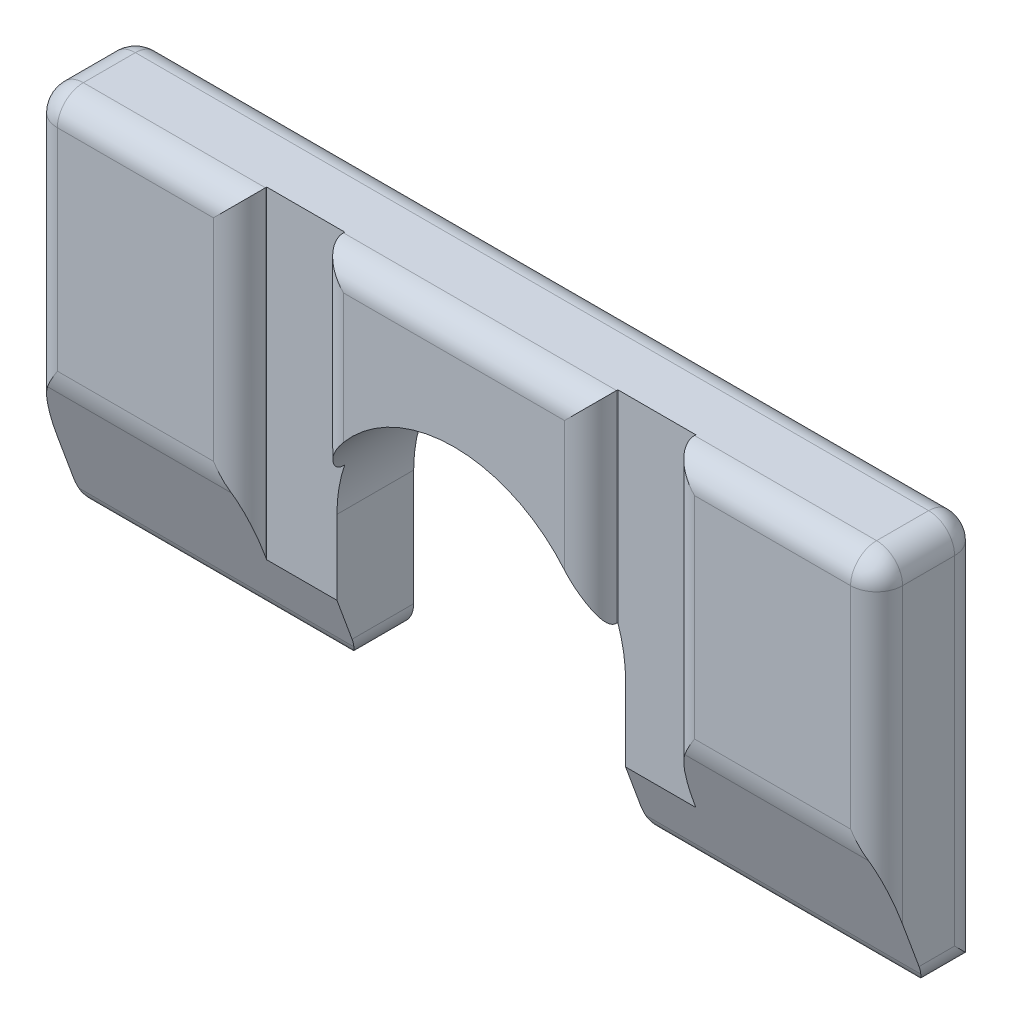
from build123d import *

# Parameters (mm, degrees)
EXTRUDE_1_DEPTH     = 8
SKETCH_3_W          = 6
SKETCH_3_H          = 30
CUT_EXTRUDE_2_DEPTH = 2.1
CUT_EXTRUDE_3_DEPTH = 68.186308129
FILLET_1_R          = 2
FILLET_2_R          = 5


with BuildPart() as part:
    # 草图1 → 凸台-拉伸1 (new body)
    with BuildSketch(Plane.XY):
        with BuildLine():
            Line((-11.1, -4.1), (-11.1, -15))
            Line((-11.1, -15), (-32.5, -15))
            Line((-32.5, -15), (-32.5, 15))
            Line((-32.5, 15), (32.5, 15))
            Line((32.5, 15), (32.5, -15))
            Line((32.5, -15), (11.1, -15))
            Line((11.1, -15), (11.1, -4.1))
            ThreePointArc((11.1, -4.1), (0, 7), (-11.1, -4.1))
        make_face()
    extrude(amount=EXTRUDE_1_DEPTH)

    # 草图3 → 切除-拉伸2 (cut)
    with BuildSketch(Plane.XY.offset(8)):
        with Locations((-13.5, 0)):
            Rectangle(SKETCH_3_W, SKETCH_3_H)
        with Locations((13.5, 0)):
            Rectangle(SKETCH_3_W, SKETCH_3_H)
    extrude(amount=-CUT_EXTRUDE_2_DEPTH, mode=Mode.SUBTRACT)

    # 草图2 → 切除-拉伸3 (cut, through all)
    with BuildSketch(Plane(origin=(32.5, 0, 0), x_dir=(0, 0, -1), z_dir=(1, 0, 0))):
        Polygon((-4, -15), (-8, -4.1), (-8, -15), align=None)
    extrude(amount=-CUT_EXTRUDE_3_DEPTH, mode=Mode.SUBTRACT)

    # 圆角1
    fillet_1_edges = [part.edges().sort_by_distance(p)[0] for p in [
        (-32.5, 0, 0),
        (0, 15, 0),
        (32.5, 0, 0),
        (24.5, 15, 8),
        (-32.5, 15, 4),
        (32.5, 15, 4),
        (-32.5, 5.45, 8),
        (0, 15, 8),
        (-24.5, 15, 8),
        (-10.5, 7.25, 8),
        (-16.5, 5.45, 8),
        (10.5, 7.25, 8),
        (16.5, 5.45, 8),
        (11.1, -15, 2),
        (-32.5, -15, 2),
        (-11.1, -15, 2),
        (32.5, 5.45, 8),
        (32.5, -15, 2),
        (21.8, -15, 4),
        (-21.8, -15, 4),
    ]]
    fillet(fillet_1_edges, radius=FILLET_1_R)

    # 圆角2
    # the kernel refuses this fillet: 5 mm, written as the material it takes off along each edge
    with BuildSketch(Plane(origin=(32.721158942, -4.1, 8), x_dir=(0, -0.9387834907734438, -0.34450770303612566), z_dir=(-1, 0, 0)), Plane(origin=(-16.278841058, -4.1, 8), x_dir=(0, -0.9387834907734438, -0.34450770303612566), z_dir=(-1, 0, 0))) as fillet_2_piece_1:
        with BuildLine():
            CenterArc((FILLET_2_R * 0.177692715394, -FILLET_2_R), FILLET_2_R, 90, 20.151747034)
            Line((-FILLET_2_R * 0.166814987642, -FILLET_2_R * 0.0612165092266), (0, 0))
            Line((0, 0), (FILLET_2_R * 0.177692715394, 0))
        make_face()
    extrude(amount=16.442317885, mode=Mode.SUBTRACT)


solid = part.part
